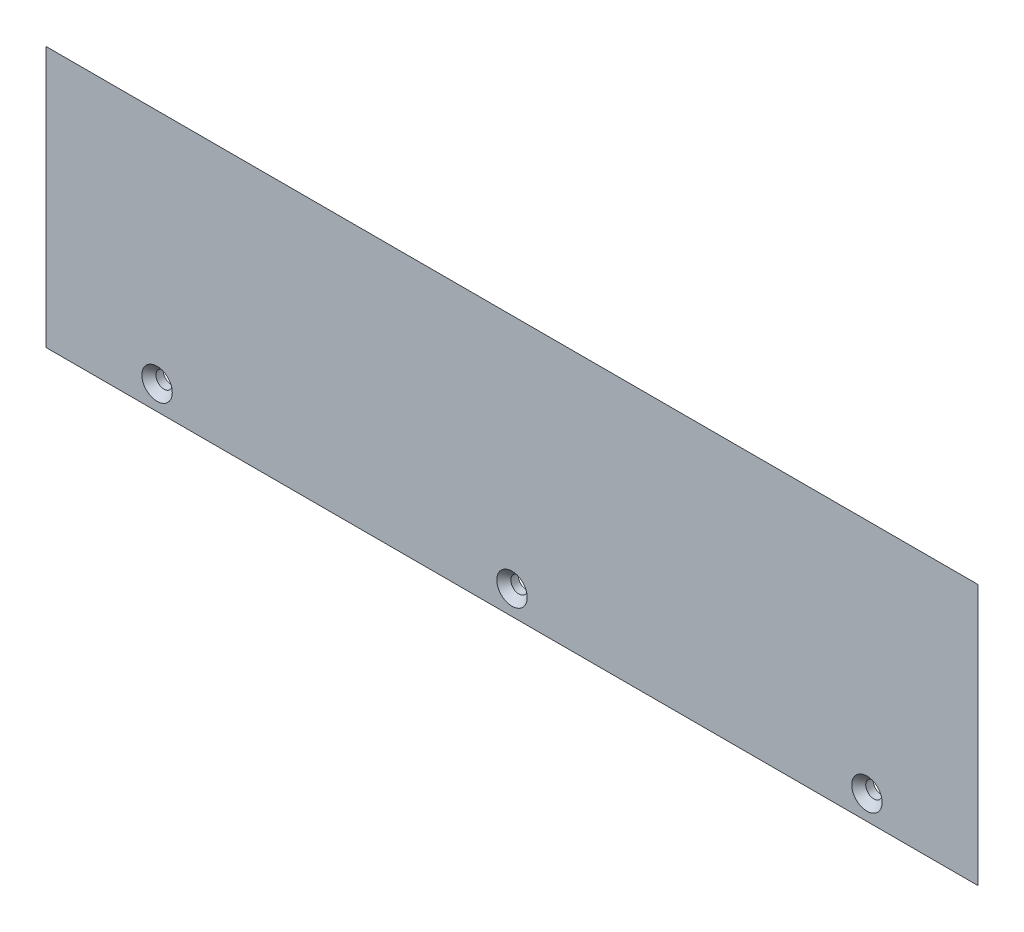
from build123d import *

# Parameters (mm, degrees)
SKETCH1_W                                      = 193
SKETCH1_H                                      = 54
BOSS_EXTRUDE1_DEPTH                            = 3
CHAMFER1_SIZE                                  = 3
CSK_FOR_M3_FLAT_HEAD_MACHINE_SCREW1_AT_2_COUNT = 2
CSK_FOR_M3_FLAT_HEAD_MACHINE_SCREW1_AT_2_PITCH = 73.5
CSK_FOR_M3_FLAT_HEAD_MACHINE_SCREW1_AT_3_COUNT = 2
CSK_FOR_M3_FLAT_HEAD_MACHINE_SCREW1_AT_3_PITCH = 147


with BuildPart() as part:
    # Sketch1 → Boss-Extrude1 (new body)
    with BuildSketch(Plane.XY):
        with Locations((96.5, 27)):
            Rectangle(SKETCH1_W, SKETCH1_H)
    extrude(amount=BOSS_EXTRUDE1_DEPTH)

    # Chamfer1
    chamfer1_edges = [part.edges().sort_by_distance(p)[0] for p in [
        (0, 27, 0),
        (96.5, 54, 0),
        (193, 27, 0),
    ]]
    chamfer(chamfer1_edges, length=CHAMFER1_SIZE - 0.0001)  # a hair under: the kernel refuses the full size

    # Sketch3 → CSK for M3 Flat Head Machine Screw1 (revolve, cut)
    with BuildSketch(Plane(origin=(23, 5, 3), x_dir=(0, -1, 0), z_dir=(1, 0, 0))):
        Polygon((0, 0), (0, 3), (1.7, 3), (1.7, 1.45), (3.15, 0), align=None)
    csk_for_m3_flat_head_machine_screw1 = revolve(axis=Axis((23, 5, 9.35), (0, 0, -1)), mode=Mode.SUBTRACT)

    # CSK for M3 Flat Head Machine Screw1 at 2: CSK for M3 Flat Head Machine Screw1 ×2
    with Locations(*[(i * CSK_FOR_M3_FLAT_HEAD_MACHINE_SCREW1_AT_2_PITCH, 0, 0) for i in range(1, CSK_FOR_M3_FLAT_HEAD_MACHINE_SCREW1_AT_2_COUNT)]):
        add(csk_for_m3_flat_head_machine_screw1, mode=Mode.SUBTRACT)

    # CSK for M3 Flat Head Machine Screw1 at 3: CSK for M3 Flat Head Machine Screw1 ×2
    with Locations(*[(i * CSK_FOR_M3_FLAT_HEAD_MACHINE_SCREW1_AT_3_PITCH, 0, 0) for i in range(1, CSK_FOR_M3_FLAT_HEAD_MACHINE_SCREW1_AT_3_COUNT)]):
        add(csk_for_m3_flat_head_machine_screw1, mode=Mode.SUBTRACT)


solid = part.part
